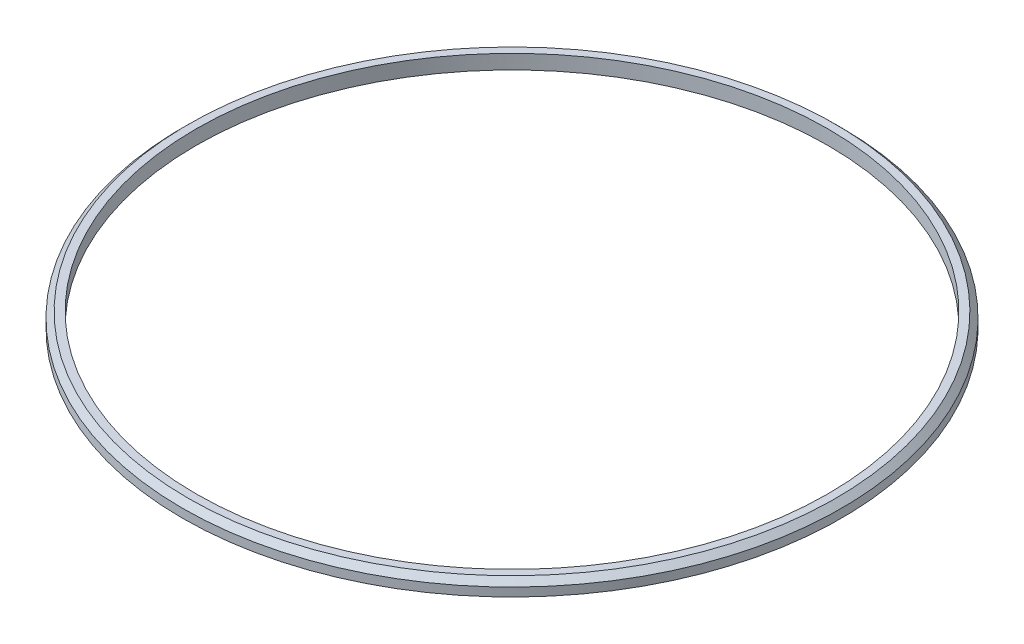
from build123d import *

# Parameters (mm, degrees)
SKETCH1_R           = 57.225
SKETCH1_R_2         = 54.875
BOSS_EXTRUDE1_DEPTH = 2.5
CHAMFER1_SIZE       = 1


with BuildPart() as part:
    # Sketch1 → Boss-Extrude1 (new body)
    with BuildSketch(Plane(origin=(0, 0, 0), x_dir=(1, 0, 0), z_dir=(0, 1, 0))):
        Circle(SKETCH1_R)
        Circle(SKETCH1_R_2, mode=Mode.SUBTRACT)
    extrude(amount=BOSS_EXTRUDE1_DEPTH)

    # Chamfer1
    chamfer1_edges = [part.edges().sort_by_distance(p)[0] for p in [
        (-57.225, 2.5, 0),
    ]]
    chamfer(chamfer1_edges, length=CHAMFER1_SIZE)


solid = part.part
